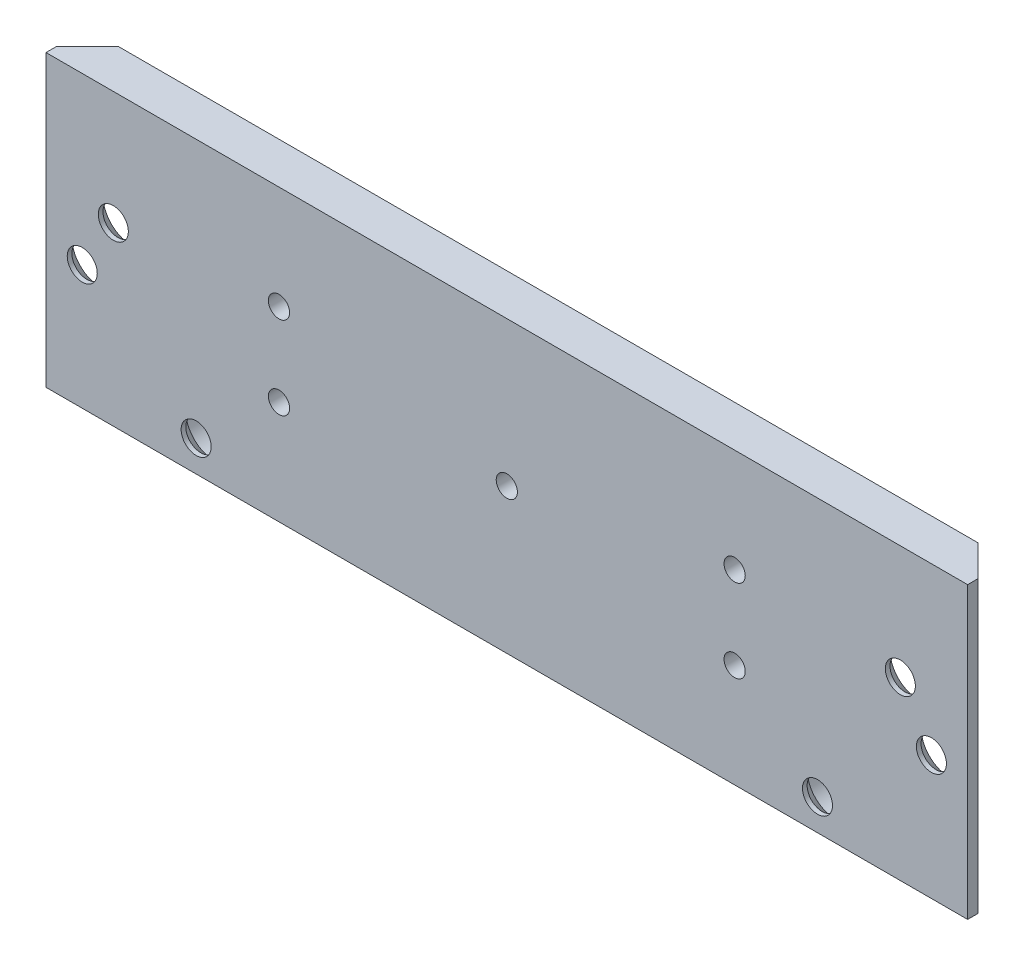
from build123d import *

# Parameters (mm, degrees)
SKETCH1_W                                      = 94
SKETCH1_H                                      = 28
BOSS_EXTRUDE1_DEPTH                            = 4
CHAMFER1_SIZE                                  = 5.5
CUT_EXTRUDE2_DEPTH                             = 48.772900268
CUT_EXTRUDE2_DEPTH_BACK                        = 48.772900268
SKETCH9_W                                      = 30.391833943
SKETCH9_H                                      = 28
SHELL1_START                                   = -11.5
SHELL1_DEPTH                                   = 23
FILLET1_R                                      = 1
CSK_FOR_M2_5_FLAT_HEAD_MACHINE_SCREW1_AT_COUNT = 2
CSK_FOR_M2_5_FLAT_HEAD_MACHINE_SCREW1_AT_PITCH = 5.830951895
CSK_FOR_M2_5_FLAT_HEAD_MACHINE_SCREW_2_COUNT   = 2
CSK_FOR_M2_5_FLAT_HEAD_MACHINE_SCREW_2_PITCH   = 16.124515497
SKETCH8_R                                      = 2.75
CUT_EXTRUDE1_DEPTH                             = 47.704523336
M2_5X0_45_TAPPED_HOLE1_D                       = 2.05
M2_5X0_45_TAPPED_HOLE1_DEPTH                   = 6
M2_5X0_45_TAPPED_HOLE1_CSINK_D                 = 2.55
M2_5X0_45_TAPPED_HOLE1_CSINK_ANGLE             = 90
M2_5X0_45_TAPPED_HOLE1_TIP                     = 0.615882135


# Read off the part's stored shape, not the designer's step: Shell1
with BuildPart() as part:
    # Sketch1 → Boss-Extrude1 (new body)
    with BuildSketch(Plane.XY):
        Rectangle(SKETCH1_W, SKETCH1_H)
    extrude(amount=BOSS_EXTRUDE1_DEPTH)

    # Chamfer1
    # the kernel refuses this chamfer: 5.5 mm, written as the material it takes off along each edge
    with BuildSketch(Plane(origin=(47, 28.144256434, 0), x_dir=(0.027495876610585942, 0, 0.9996219169112968), z_dir=(0, -1, 0)), Plane(origin=(-47, -28.144256434, 0), x_dir=(-0.027495876610585942, 0, 0.9996219169112968), z_dir=(0, 1, 0))) as chamfer1_piece_1:
        Polygon((CHAMFER1_SIZE * 0.999621916911, CHAMFER1_SIZE * 0.0274958766106), (-CHAMFER1_SIZE * 0.0274958766106, CHAMFER1_SIZE * 0.999621916911), (0, 0), align=None)
    extrude(amount=56.288512868, mode=Mode.SUBTRACT)

    # Sketch9 → Cut-Extrude2 (cut, two sides: drawn at the far end of the back side and taken through both)
    with BuildSketch(Plane(origin=(0, 0, 0), x_dir=(-1, 0, 0), z_dir=(0, 0, -1)).offset(-CUT_EXTRUDE2_DEPTH_BACK)):
        with Locations((-59.695916972, 0)):
            Rectangle(SKETCH9_W, SKETCH9_H)
        with Locations((59.695916972, 0)):
            Rectangle(SKETCH9_W, SKETCH9_H)
    extrude(amount=CUT_EXTRUDE2_DEPTH + CUT_EXTRUDE2_DEPTH_BACK, mode=Mode.SUBTRACT)

    # Shell1 outline → Shell1 (cut)
    with BuildSketch(Plane(origin=(0, 0, 0), x_dir=(1, 0, 0), z_dir=(0, 1, 0)).offset(SHELL1_START)):
        Polygon((-41.5, 0), (-43.75, -2.25), (43.75, -2.25), (41.5, 0), align=None)
    extrude(amount=SHELL1_DEPTH, mode=Mode.SUBTRACT)

    # Fillet1
    fillet1_edges = [part.edges().sort_by_distance(p)[0] for p in [
        (0, 11.5, 2.25),
        (0, -11.5, 2.25),
    ]]
    fillet(fillet1_edges, radius=FILLET1_R)

    # Sketch5 → CSK for M2.5 Flat Head Machine Screw1 (revolve, cut)
    with BuildSketch(Plane(origin=(38, 3, 2.25), x_dir=(0, 1, 0), z_dir=(1, 0, 0))):
        Polygon((0, 0), (0, 7.321247898), (1.45, 6.45), (1.45, 1.3), (2.75, 0), align=None)
    csk_for_m2_5_flat_head_machine_screw1 = revolve(axis=Axis((38, 3, -4.1), (0, 0, 1)), mode=Mode.SUBTRACT)

    # CSK for M2.5 Flat Head Machine Screw1 at: CSK for M2.5 Flat Head Machine Screw1 ×2
    with Locations(*[Vector(0.5144957554275275, -0.8574929257125438, 0) * (i * CSK_FOR_M2_5_FLAT_HEAD_MACHINE_SCREW1_AT_PITCH) for i in range(1, CSK_FOR_M2_5_FLAT_HEAD_MACHINE_SCREW1_AT_COUNT)]):
        add(csk_for_m2_5_flat_head_machine_screw1, mode=Mode.SUBTRACT)

    # CSK for M2.5 Flat Head Machine Screw 2: CSK for M2.5 Flat Head Machine Screw1 ×2
    with Locations(*[Vector(-0.4961389383568334, -0.8682431421244594, 0) * (i * CSK_FOR_M2_5_FLAT_HEAD_MACHINE_SCREW_2_PITCH) for i in range(1, CSK_FOR_M2_5_FLAT_HEAD_MACHINE_SCREW_2_COUNT)]):
        add(csk_for_m2_5_flat_head_machine_screw1, mode=Mode.SUBTRACT)

    # Sketch8 → Cut-Extrude1 (cut, through all)
    with BuildSketch(Plane(origin=(0, 0, 2.25), x_dir=(-1, 0, 0), z_dir=(0, 0, -1))):
        with Locations((-30, -11)):
            Circle(SKETCH8_R)
    cut_extrude1 = extrude(amount=CUT_EXTRUDE1_DEPTH, mode=Mode.SUBTRACT)

    # Mirror1: CSK for M2.5 Flat Head Machine Screw1, Cut-Extrude1 across plane
    add(csk_for_m2_5_flat_head_machine_screw1.mirror(Plane(origin=(0, 0, 0), x_dir=(0, 0, 1), z_dir=(1, 0, 0))), mode=Mode.SUBTRACT)
    add(cut_extrude1.mirror(Plane(origin=(0, 0, 0), x_dir=(0, 0, 1), z_dir=(1, 0, 0))), mode=Mode.SUBTRACT)

    # Mirror1 copy 1 sketch → Mirror1 copy 1 (revolve, cut)
    with BuildSketch(Plane(origin=(-41, -2, 2.25), x_dir=(0, 1, 0), z_dir=(-1, 0, 0))):
        Polygon((0, 0), (0, -7.321247898), (1.45, -6.45), (1.45, -1.3), (2.75, 0), align=None)
    revolve(axis=Axis((-41, -2, -4.1), (0, 0, -1)), mode=Mode.SUBTRACT)

    # Mirror1 copy 2 sketch → Mirror1 copy 2 (revolve, cut)
    with BuildSketch(Plane(origin=(-30, -11, 2.25), x_dir=(0, 1, 0), z_dir=(-1, 0, 0))):
        Polygon((0, 0), (0, -7.321247898), (1.45, -6.45), (1.45, -1.3), (2.75, 0), align=None)
    revolve(axis=Axis((-30, -11, -4.1), (0, 0, -1)), mode=Mode.SUBTRACT)

    # M2.5x0.45 Tapped Hole1
    with Locations(Plane(origin=(0, 0, 2.25), x_dir=(-1, 0, 0), z_dir=(0, 0, -1))):
        with Locations((0, 0), (-22, 4), (-22, -4), (22, -4), (22, 4)):
            CounterSinkHole(M2_5X0_45_TAPPED_HOLE1_D / 2, M2_5X0_45_TAPPED_HOLE1_CSINK_D / 2, depth=M2_5X0_45_TAPPED_HOLE1_DEPTH, counter_sink_angle=M2_5X0_45_TAPPED_HOLE1_CSINK_ANGLE)
            with Locations((0, 0, -(M2_5X0_45_TAPPED_HOLE1_DEPTH + M2_5X0_45_TAPPED_HOLE1_TIP / 2))):  # 118° drill point
                Cone(0, M2_5X0_45_TAPPED_HOLE1_D / 2, M2_5X0_45_TAPPED_HOLE1_TIP, mode=Mode.SUBTRACT)


solid = part.part
